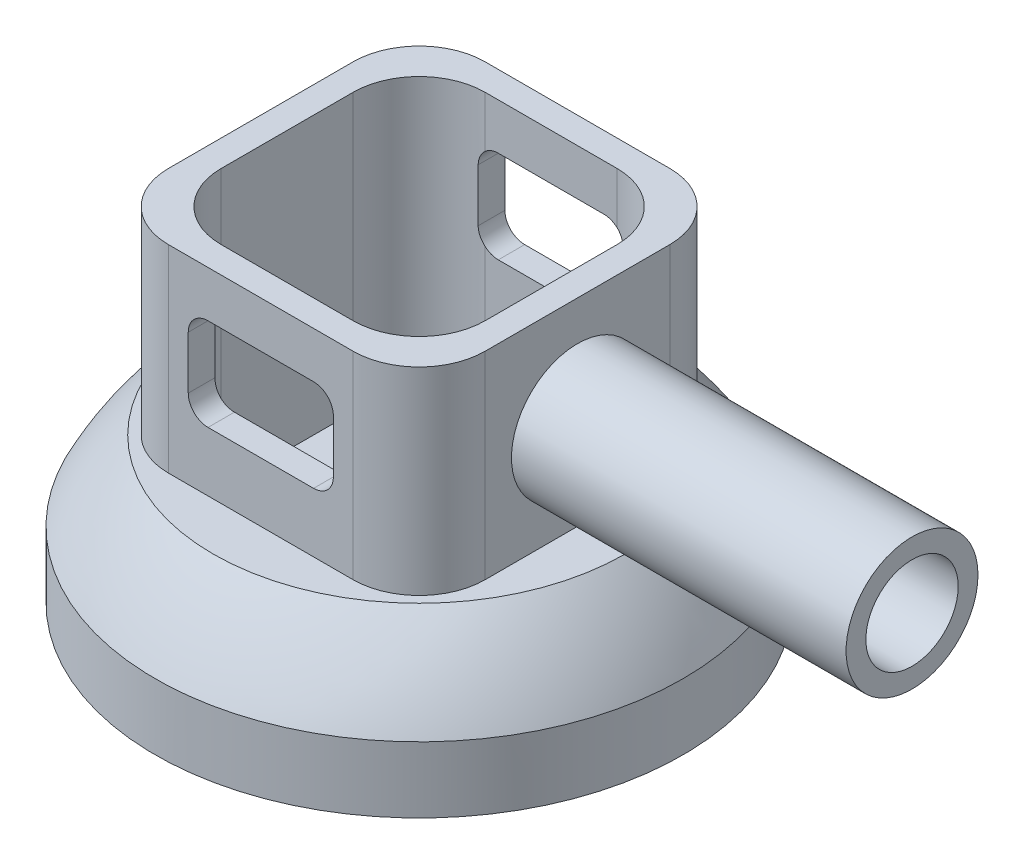
from build123d import *

# Parameters (mm, degrees)
SKETCH_3_R                      = 2.8
CUT_EXTRUDE_2_DEPTH             = 4
SKETCH_8_R                      = 1.5
CUT_EXTRUDE_5_DEPTH             = 4
SKETCH_10_W                     = 24
SKETCH_10_H                     = 24
SKETCH_10_W_2                   = 20
SKETCH_10_H_2                   = 20
EXTRUDE_1_DEPTH                 = 15
EXTRUDE_2_DEPTH                 = 15
EXTRUDE_2_DEPTH_BACK            = 12
SKETCH_7_R                      = 5
SKETCH_7_R_2                    = 3.5
SKETCH_7_5_R                    = 3.5
CUT_EXTRUDE_6_DEPTH             = 12.360679775
FILLET_START                    = 6
FILLET_1_DEPTH                  = 15
FILLET_1_2_DEPTH                = 15
CUT_EXTRUDE_7_REACH             = 55.487
CUT_EXTRUDE_7_DIRECTION_2_DEPTH = 54.486637521
SKETCH_15_R                     = 20
EXTRUDE_3_DEPTH                 = 5
CUT_EXTRUDE_START               = -6
CUT_EXTRUDE_9_DEPTH             = 6
SKETCH_17_R                     = 1.5
CUT_EXTRUDE_10_DEPTH            = 8
SKETCH_18_R                     = 2.8
CUT_EXTRUDE_11_DEPTH            = 4


with BuildPart() as part:
    # 草图1 → 旋转1 (revolve)
    with BuildSketch(Plane.XY):
        with BuildLine():
            ThreePointArc((-15.620499352, 6), (-18.061145964, 3.183133409), (-20, 0))
            Line((-20, 0), (0, 0))
            Line((0, 0), (0, 6))
            Line((0, 6), (-15.620499352, 6))
        make_face()
    revolve(axis=Axis((0, 10, 0), (0, -1, 0)))

    # 草图3 → 切除-拉伸2 (cut)
    with BuildSketch(Plane.XZ):
        with Locations(Location((0, 0, 0), (0, 0, 270))):
            Circle(SKETCH_3_R)
    extrude(amount=-CUT_EXTRUDE_2_DEPTH, mode=Mode.SUBTRACT)

    # 草图8 → 切除-拉伸5 (cut)
    with BuildSketch(Plane.XZ.offset(-4)):
        with Locations(Location((0, 0, 0), (0, 0, 270))):
            Circle(SKETCH_8_R)
    extrude(amount=-CUT_EXTRUDE_5_DEPTH, mode=Mode.SUBTRACT)

    # 草图10 → 拉伸-薄壁1 (add)
    with BuildSketch(Plane(origin=(0, 6, 0), x_dir=(1, 0, 0), z_dir=(0, 1, 0))):
        Rectangle(SKETCH_10_W, SKETCH_10_H)
        Rectangle(SKETCH_10_W_2, SKETCH_10_H_2, mode=Mode.SUBTRACT)
    extrude(amount=EXTRUDE_1_DEPTH)

    # 草图7 → 凸台-拉伸2 (add, two sides: drawn at the far end of the back side and taken through both)
    with BuildSketch(Plane(origin=(22.360679775, 0, 0), x_dir=(0, 0, -1), z_dir=(1, 0, 0)).offset(-EXTRUDE_2_DEPTH_BACK)):
        with Locations((0, 13)):
            Circle(SKETCH_7_R)
        with Locations((0, 13)):
            Circle(SKETCH_7_R_2, mode=Mode.SUBTRACT)
    extrude(amount=EXTRUDE_2_DEPTH + EXTRUDE_2_DEPTH_BACK)

    # 草图7<5> → 切除-拉伸6 (cut)
    with BuildSketch(Plane(origin=(22.360679775, 0, 0), x_dir=(0, 0, -1), z_dir=(1, 0, 0))):
        with Locations((0, 13)):
            Circle(SKETCH_7_5_R)
    extrude(amount=-CUT_EXTRUDE_6_DEPTH, mode=Mode.SUBTRACT)

    # 圆角1: read off the stored shape, not the designer's step
    # 圆角1 outline → 圆角1 (cut)
    with BuildSketch(Plane(origin=(0, 0, 0), x_dir=(1, 0, 0), z_dir=(0, 1, 0)).offset(FILLET_START)):
        with BuildLine():
            ThreePointArc((-12, 7), (-10.535533906, 10.535533906), (-7, 12))
            Line((-7, 12), (-12, 12))
            Line((-12, 12), (-12, 7))
        make_face()
        with BuildLine():
            Line((12, 12), (7, 12))
            ThreePointArc((7, 12), (10.535533906, 10.535533906), (12, 7))
            Line((12, 7), (12, 12))
        make_face()
        with BuildLine():
            ThreePointArc((-7, -12), (-10.535533906, -10.535533906), (-12, -7))
            Line((-12, -7), (-12, -12))
            Line((-12, -12), (-7, -12))
        make_face()
        with BuildLine():
            Line((12, -12), (12, -7))
            ThreePointArc((12, -7), (10.535533906, -10.535533906), (7, -12))
            Line((7, -12), (12, -12))
        make_face()
    extrude(amount=FILLET_1_DEPTH, mode=Mode.SUBTRACT)

    # Fillet 1 2 outline → Fillet 1 2 (add)
    with BuildSketch(Plane(origin=(0, 0, 0), x_dir=(1, 0, 0), z_dir=(0, 1, 0)).offset(FILLET_START)):
        with BuildLine():
            Line((10, -10), (10, -5))
            ThreePointArc((10, -5), (8.535533906, -8.535533906), (5, -10))
            Line((5, -10), (10, -10))
        make_face()
        with BuildLine():
            ThreePointArc((5, 10), (8.535533906, 8.535533906), (10, 5))
            Line((10, 5), (10, 10))
            Line((10, 10), (5, 10))
        make_face()
        with BuildLine():
            Line((-10, -10), (-5, -10))
            ThreePointArc((-5, -10), (-8.535533906, -8.535533906), (-10, -5))
            Line((-10, -5), (-10, -10))
        make_face()
        with BuildLine():
            ThreePointArc((-10, 5), (-8.535533906, 8.535533906), (-5, 10))
            Line((-5, 10), (-10, 10))
            Line((-10, 10), (-10, 5))
        make_face()
    extrude(amount=FILLET_1_2_DEPTH)

    # 切除-拉伸7: up to this face of the body (flat: up to its plane)
    cut_extrude_7_end = Plane(part.part.faces().sort_by_distance((0, 13.5, -12))[0])
    # 草图13 → 切除-拉伸7 (cut, up to the picked face)
    with BuildSketch(Plane.XY.offset(12), mode=Mode.PRIVATE) as cut_extrude_7_sk1:
        with BuildLine():
            Line((-4, 17.5), (4, 17.5))
            ThreePointArc((4, 17.5), (5.060660172, 17.060660172), (5.5, 16))
            Line((5.5, 16), (5.5, 12))
            ThreePointArc((5.5, 12), (5.060660172, 10.939339828), (4, 10.5))
            Line((4, 10.5), (-4, 10.5))
            ThreePointArc((-4, 10.5), (-5.060660172, 10.939339828), (-5.5, 12))
            Line((-5.5, 12), (-5.5, 16))
            ThreePointArc((-5.5, 16), (-5.060660172, 17.060660172), (-4, 17.5))
        make_face()
    cut_extrude_7_tool1 = split(extrude(cut_extrude_7_sk1.sketch, amount=-CUT_EXTRUDE_7_REACH, mode=Mode.PRIVATE), bisect_by=cut_extrude_7_end, keep=Keep.BOTH, mode=Mode.PRIVATE)
    add(cut_extrude_7_tool1.solids().sort_by(Axis((0, 14, 12), (0, 0, -1)))[0], mode=Mode.SUBTRACT)

    # 草图13 → 切除-拉伸7 direction 2 (cut)
    with BuildSketch(Plane.XY.offset(12)):
        with BuildLine():
            Line((-4, 17.5), (4, 17.5))
            ThreePointArc((4, 17.5), (5.060660172, 17.060660172), (5.5, 16))
            Line((5.5, 16), (5.5, 12))
            ThreePointArc((5.5, 12), (5.060660172, 10.939339828), (4, 10.5))
            Line((4, 10.5), (-4, 10.5))
            ThreePointArc((-4, 10.5), (-5.060660172, 10.939339828), (-5.5, 12))
            Line((-5.5, 12), (-5.5, 16))
            ThreePointArc((-5.5, 16), (-5.060660172, 17.060660172), (-4, 17.5))
        make_face()
    extrude(amount=CUT_EXTRUDE_7_DIRECTION_2_DEPTH, mode=Mode.SUBTRACT)

    # 草图15 → 凸台-拉伸3 (add)
    with BuildSketch(Plane.XZ):
        with Locations(Location((0, 0, 0), (0, 0, 180))):
            Circle(SKETCH_15_R)
    extrude(amount=EXTRUDE_3_DEPTH)

    # 草图16 → 切除-拉伸9 (cut)
    with BuildSketch(Plane(origin=(0, 6, 0), x_dir=(1, 0, 0), z_dir=(0, 1, 0)).offset(CUT_EXTRUDE_START)):
        with BuildLine():
            Line((-5, -10), (5, -10))
            ThreePointArc((5, -10), (8.535533906, -8.535533906), (10, -5))
            Line((10, -5), (10, 5))
            ThreePointArc((10, 5), (8.535533906, 8.535533906), (5, 10))
            Line((5, 10), (-5, 10))
            ThreePointArc((-5, 10), (-8.535533906, 8.535533906), (-10, 5))
            Line((-10, 5), (-10, -5))
            ThreePointArc((-10, -5), (-8.535533906, -8.535533906), (-5, -10))
        make_face()
    extrude(amount=CUT_EXTRUDE_9_DEPTH, mode=Mode.SUBTRACT)

    # 草图17 → 切除-拉伸10 (cut)
    with BuildSketch(Plane(origin=(0, 0, 0), x_dir=(1, 0, 0), z_dir=(0, 1, 0))):
        with Locations(Location((0, 0, 0), (0, 0, 270))):
            Circle(SKETCH_17_R)
    extrude(amount=-CUT_EXTRUDE_10_DEPTH, mode=Mode.SUBTRACT)

    # 草图18 → 切除-拉伸11 (cut)
    with BuildSketch(Plane.XZ.offset(5)):
        with Locations(Location((0, 0, 0), (0, 0, 270))):
            Circle(SKETCH_18_R)
    extrude(amount=-CUT_EXTRUDE_11_DEPTH, mode=Mode.SUBTRACT)


solid = part.part
